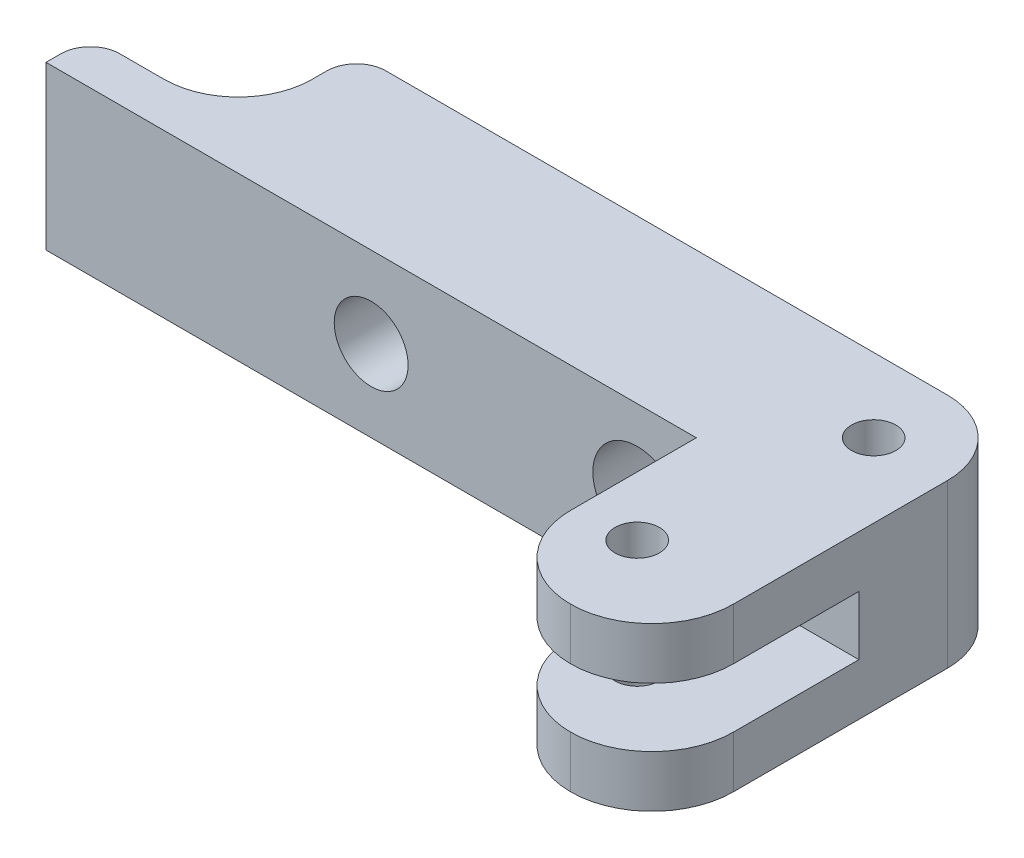
from build123d import *

# Parameters (mm, degrees)
BOSS_EXTRUDE1_DEPTH = 11
FILLET1_R           = 2
FILLET2_R           = 5
FILLET3_R           = 2
FILLET4_R           = 5
FILLET5_R           = 5.5
FILLET6_R           = 5.5
SKETCH2_W           = 22.197918088
SKETCH2_H           = 4
CUT_EXTRUDE1_DEPTH  = 11
SKETCH3_R           = 1.5
CUT_EXTRUDE2_DEPTH  = 11
SKETCH4_R           = 3
CUT_EXTRUDE3_DEPTH  = 31
SKETCH5_R           = 2.5
CUT_EXTRUDE4_DEPTH  = 31
SKETCH6_R           = 1.5
CUT_EXTRUDE5_DEPTH  = 31


with BuildPart() as part:
    # Sketch1 → Boss-Extrude1 (new body)
    with BuildSketch(Plane(origin=(0, 0, 0), x_dir=(1, 0, 0), z_dir=(0, 1, 0))):
        Polygon((0, 0), (0, 3), (10, 3), (10, 11), (55, 11), (55, -14), (44, -14), (44, 0), align=None)
    extrude(amount=BOSS_EXTRUDE1_DEPTH)

    # Fillet1
    fillet1_edges = [part.edges().sort_by_distance(p)[0] for p in [
        (0, 5.5, -3),
    ]]
    fillet(fillet1_edges, radius=FILLET1_R)

    # Fillet2
    fillet2_edges = [part.edges().sort_by_distance(p)[0] for p in [
        (10, 5.5, -3),
    ]]
    fillet(fillet2_edges, radius=FILLET2_R)

    # Fillet3
    fillet3_edges = [part.edges().sort_by_distance(p)[0] for p in [
        (10, 5.5, -11),
    ]]
    fillet(fillet3_edges, radius=FILLET3_R)

    # Fillet4
    fillet4_edges = [part.edges().sort_by_distance(p)[0] for p in [
        (55, 5.5, -11),
    ]]
    fillet(fillet4_edges, radius=FILLET4_R)

    # Fillet5
    fillet5_edges = [part.edges().sort_by_distance(p)[0] for p in [
        (44, 5.5, 14),
    ]]
    fillet(fillet5_edges, radius=FILLET5_R)

    # Fillet6
    fillet6_edges = [part.edges().sort_by_distance(p)[0] for p in [
        (55, 5.5, 14),
    ]]
    fillet(fillet6_edges, radius=FILLET6_R - 0.0001)  # a hair under: the kernel refuses the full size

    # Sketch2 → Cut-Extrude1 (cut)
    with BuildSketch(Plane.ZY.offset(-44)):
        with Locations((11.098959044, 5.5)):
            Rectangle(SKETCH2_W, SKETCH2_H)
    extrude(amount=-CUT_EXTRUDE1_DEPTH, mode=Mode.SUBTRACT)

    # Sketch3 → Cut-Extrude2 (cut)
    with BuildSketch(Plane(origin=(0, 11, 0), x_dir=(1, 0, 0), z_dir=(0, 1, 0))):
        with Locations(Location((48, -8, 0), (0, 0, 270))):
            Circle(SKETCH3_R)
    extrude(amount=-CUT_EXTRUDE2_DEPTH, mode=Mode.SUBTRACT)

    # Sketch4 → Cut-Extrude3 (cut)
    with BuildSketch(Plane(origin=(0, 0, -11), x_dir=(-1, 0, 0), z_dir=(0, 0, -1))):
        with Locations((-40, 5.5)):
            Circle(SKETCH4_R)
    extrude(amount=-CUT_EXTRUDE3_DEPTH, mode=Mode.SUBTRACT)

    # Sketch5 → Cut-Extrude4 (cut)
    with BuildSketch(Plane(origin=(0, 0, -11), x_dir=(-1, 0, 0), z_dir=(0, 0, -1))):
        with Locations((-22, 5.5)):
            Circle(SKETCH5_R)
    extrude(amount=-CUT_EXTRUDE4_DEPTH, mode=Mode.SUBTRACT)

    # Sketch6 → Cut-Extrude5 (cut)
    with BuildSketch(Plane(origin=(0, 11, 0), x_dir=(1, 0, 0), z_dir=(0, 1, 0))):
        with Locations(Location((50, 6, 0), (0, 0, 270))):
            Circle(SKETCH6_R)
    extrude(amount=-CUT_EXTRUDE5_DEPTH, mode=Mode.SUBTRACT)


solid = part.part
